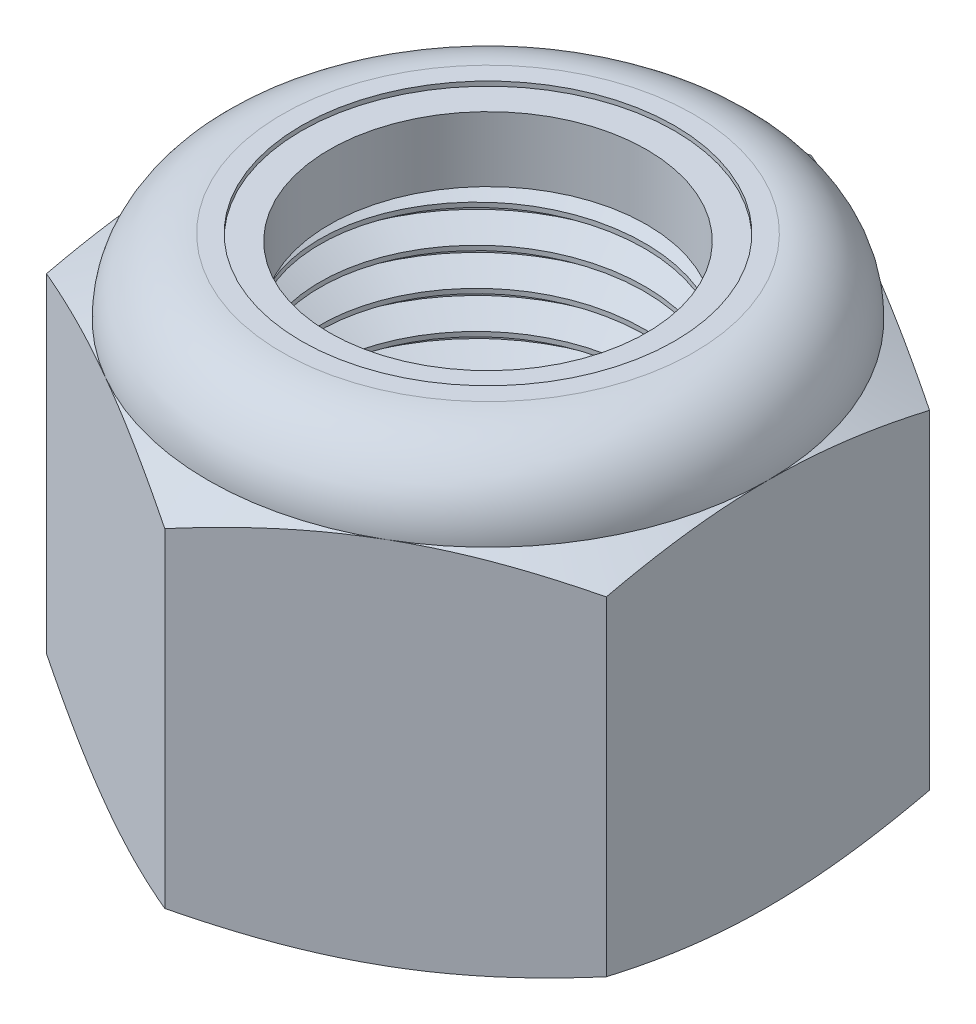
from build123d import *

# Parameters (mm, degrees)
SKETCH13_R       = 6.35
EXTRUDE1_DEPTH   = 15.08125
SKETCH2_W        = 6.35
SKETCH2_H        = 12.567708333
CUT_SWEEP1_PITCH = 1.27
SKETCH12_W       = 6.985
SKETCH12_H       = 12.567708333


with BuildPart() as part:
    # Sketch13 → Extrude1 (new body)
    with BuildSketch(Plane(origin=(0, 0, 0), x_dir=(1, 0, 0), z_dir=(0, 1, 0))):
        Polygon((0, 10.998522628), (-9.525, 5.499261314), (-9.525, -5.499261314), (0, -10.998522628), (9.525, -5.499261314), (9.525, 5.499261314), align=None)
        with Locations(Location((0, 0, 0), (0, 0, 270))):
            Circle(SKETCH13_R, mode=Mode.SUBTRACT)
    extrude(amount=EXTRUDE1_DEPTH)

    # Sketch5 → Cut-Revolve3 (revolve, cut)
    with BuildSketch(Plane(origin=(0, 0, 0), x_dir=(0, 0, -1), z_dir=(1, 0, 0))):
        with BuildLine():
            Line((0, 0), (9.525, 0))
            Line((9.525, 0), (10.998522628, 0.687114886))
            Line((10.998522628, 0.687114886), (10.998522628, 11.880593447))
            Line((10.998522628, 11.880593447), (9.525, 12.567708333))
            ThreePointArc((9.525, 12.567708333), (8.788800691, 14.345050691), (7.011458333, 15.08125))
            Line((7.011458333, 15.08125), (7.011458333, 16.35125))
            Line((7.011458333, 16.35125), (12.268522628, 16.35125))
            Line((12.268522628, 16.35125), (12.268522628, -1.27))
            Line((12.268522628, -1.27), (0, -1.27))
            Line((0, -1.27), (0, 0))
        make_face()
    revolve(axis=Axis((0, 0, 0), (0, 1, 0)), mode=Mode.SUBTRACT)

    # Sketch6 → Cut-Revolve4 (revolve, cut)
    with BuildSketch(Plane(origin=(0, 0, 0), x_dir=(0, 0, -1), z_dir=(1, 0, 0)), mode=Mode.PRIVATE) as cut_revolve4_sk:
        with BuildLine():
            Line((0, 12.567708333), (9.3726, 12.567708333))
            ThreePointArc((9.3726, 12.567708333), (8.681037617, 14.237287617), (7.011458333, 14.92885))
            Line((7.011458333, 14.92885), (3.505729167, 14.92885))
            Line((3.505729167, 14.92885), (3.505729167, 16.35125))
            Line((3.505729167, 16.35125), (0, 16.35125))
            Line((0, 16.35125), (0, 12.567708333))
        make_face()
    revolve(cut_revolve4_sk.sketch.rotate(Axis((0, 16.35125, 0), (0, -1, 0)), 180), axis=Axis((0, 16.35125, 0), (0, -1, 0)), mode=Mode.SUBTRACT)

    # Sketch4 → Cut-Revolve2 (revolve, cut)
    with BuildSketch(Plane(origin=(0, 0, 0), x_dir=(0, 0, -1), z_dir=(1, 0, 0))):
        Polygon((0, 12.567708333), (6.985, 12.567708333), (0, 9.310549341), align=None)
        Polygon((0, 3.257158992), (6.985, 0), (0, 0), align=None)
    revolve(axis=Axis((0, 0, 0), (0, 1, 0)), mode=Mode.SUBTRACT)

    # Sketch12 → Revolve4 (revolve)
    with BuildSketch(Plane(origin=(0, 0, 0), x_dir=(0, 0, -1), z_dir=(1, 0, 0)), mode=Mode.PRIVATE) as revolve4_sk:
        with Locations((3.4925, 6.283854167)):
            Rectangle(SKETCH12_W, SKETCH12_H)
    revolve(revolve4_sk.sketch.rotate(Axis((0, 0, 0), (0, 1, 0)), 50.66371137), axis=Axis((0, 0, 0), (0, 1, 0)))


with BuildPart() as body_2:
    # Sketch7 → Revolve2 (revolve)
    with BuildSketch(Plane(origin=(0, 0, 0), x_dir=(0, 0, -1), z_dir=(1, 0, 0))):
        with BuildLine():
            Line((5.3975, 12.643908333), (9.295129058, 12.643908333))
            ThreePointArc((9.295129058, 12.643908333), (8.599986877, 14.210125907), (7.011458333, 14.85265))
            Line((7.011458333, 14.85265), (5.3975, 14.85265))
            Line((5.3975, 14.85265), (5.3975, 12.643908333))
        make_face()
    revolve(axis=Axis((0, 12.643908333, 0), (0, 1, 0)))


with BuildPart() as body_3:
    # Sketch2 → Revolve1 (revolve)
    with BuildSketch(Plane(origin=(0, 0, 0), x_dir=(0, 0, -1), z_dir=(1, 0, 0))):
        with Locations((3.175, 6.283854167)):
            Rectangle(SKETCH2_W, SKETCH2_H)
    revolve(axis=Axis((0, -6.35, 0), (0, 1, 0)))

    # Cut-Sweep1: the profile of Sketch9 screwed along a right-hand helix of 12.875 turns, 8 arcs to a turn; built about Z, then put on its axis
    cut_sweep1_z = Axis((0, 0, 0), (0, 0, 1))
    cut_sweep1_corners = [(6.487481533, 0, 0.079375), (6.418740766, 0, -1.1509375), (5.525110803, 0, -0.635), (5.525110803, 0, -0.47625)]
    with BuildLine(mode=Mode.PRIVATE) as cut_sweep1_profile:
        Line(cut_sweep1_corners[0], cut_sweep1_corners[1])
        Line(cut_sweep1_corners[1], cut_sweep1_corners[2])
        Line(cut_sweep1_corners[2], cut_sweep1_corners[3])
        Line(cut_sweep1_corners[3], cut_sweep1_corners[0])
    cut_sweep1_cap = Face(cut_sweep1_profile.wire())
    cut_sweep1_turn_angles = [0, 22.5, 45, 67.5, 90, 112.5, 135, 157.5, 180, 202.5, 225, 247.5, 270, 292.5, 315, 337.5, 360]
    cut_sweep1_turn_weights = [1, 0.9238795325112867, 1, 0.9238795325112867, 1, 0.9238795325112867, 1, 0.9238795325112867, 1, 0.9238795325112867, 1, 0.9238795325112867, 1, 0.9238795325112867, 1, 0.9238795325112867, 1]
    cut_sweep1_turn_rails = [Edge.make_bspline([Vector(p[0], p[1], 0).rotate(cut_sweep1_z, cut_sweep1_turn_angles[k]) / cut_sweep1_turn_weights[k] + Vector(0, 0, p[2] + CUT_SWEEP1_PITCH * cut_sweep1_turn_angles[k] / 360) for k in range(17)], [0, 0, 0, 1, 1, 2, 2, 3, 3, 4, 4, 5, 5, 6, 6, 7, 7, 8, 8, 8], 2, cut_sweep1_turn_weights) for p in cut_sweep1_corners]
    cut_sweep1_turn_sides = [Face.make_surface_from_curves(cut_sweep1_turn_rails[p[0]], cut_sweep1_turn_rails[p[1]]) for p in [(0, 1), (1, 2), (2, 3), (3, 0)]]
    cut_sweep1_last_angles = [4320, 4342.5, 4365, 4387.5, 4410, 4432.5, 4455, 4477.5, 4500, 4522.5, 4545, 4567.5, 4590, 4612.5, 4635]
    cut_sweep1_last_weights = [1, 0.9238795325112867, 1, 0.9238795325112867, 1, 0.9238795325112867, 1, 0.9238795325112867, 1, 0.9238795325112867, 1, 0.9238795325112867, 1, 0.9238795325112958, 1]
    cut_sweep1_last_rails = [Edge.make_bspline([Vector(p[0], p[1], 0).rotate(cut_sweep1_z, cut_sweep1_last_angles[k]) / cut_sweep1_last_weights[k] + Vector(0, 0, p[2] + CUT_SWEEP1_PITCH * cut_sweep1_last_angles[k] / 360) for k in range(15)], [0, 0, 0, 1, 1, 2, 2, 3, 3, 4, 4, 5, 5, 6, 6, 7, 7, 7], 2, cut_sweep1_last_weights) for p in cut_sweep1_corners]
    cut_sweep1_last_sides = [Face.make_surface_from_curves(cut_sweep1_last_rails[p[0]], cut_sweep1_last_rails[p[1]]) for p in [(0, 1), (1, 2), (2, 3), (3, 0)]]
    cut_sweep1 = Plane(origin=(0, 12.567708333, 0), x_dir=(0, 0, -1), z_dir=(0, -1, 0)) * Solid(Shell([*[p.moved(Location((0, 0, CUT_SWEEP1_PITCH * i))) for i in range(12) for p in cut_sweep1_turn_sides], *cut_sweep1_last_sides, cut_sweep1_cap, cut_sweep1_cap.rotate(cut_sweep1_z, 4635).moved(Location((0, 0, CUT_SWEEP1_PITCH * 4635 / 360)))]))
    add(cut_sweep1, mode=Mode.SUBTRACT)

    # Sketch11 → Revolve3 (revolve)
    with BuildSketch(Plane(origin=(0, 0, 0), x_dir=(0, 0, -1), z_dir=(1, 0, 0))):
        Polygon((0, 0), (6.985, 0), (0, 3.257158992), align=None)
    revolve(axis=Axis((0, 15.08125, 0), (0, -1, 0)))


with BuildPart() as part_1:
    add(part.part)

    # Combine1: cut body 3
    add(body_3.part, mode=Mode.SUBTRACT)


solid = Compound([body_2.part, part_1.part])
